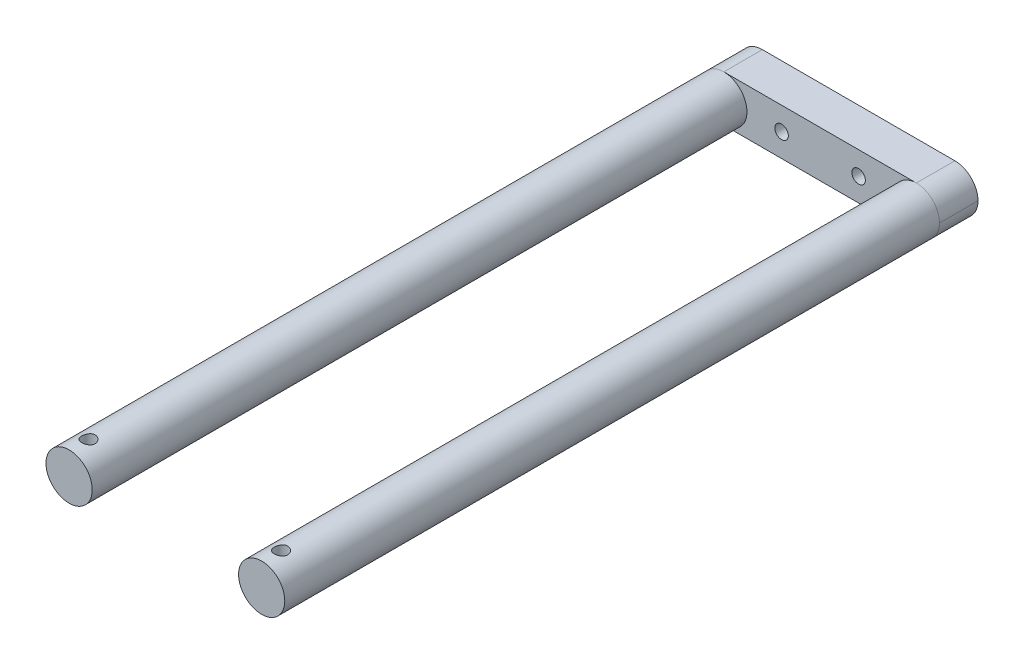
from build123d import *

# Parameters (mm, degrees)
SKETCH1_W               = 62
SKETCH1_H               = 12
BOSS_EXTRUDE1_DEPTH     = 10
SKETCH2_R               = 6
BOSS_EXTRUDE2_DEPTH     = 170
FILLET1_R               = 6
CUT_EXTRUDE3_DEPTH      = 183.748461006
CUT_EXTRUDE3_DEPTH_BACK = 183.748461006
SKETCH6_R               = 1.75
CUT_EXTRUDE4_REACH      = 184.748
SKETCH7_R               = 1.75


with BuildPart() as part:
    # Sketch1 → Boss-Extrude1 (new body)
    with BuildSketch(Plane.XY):
        Rectangle(SKETCH1_W, SKETCH1_H)
    extrude(amount=BOSS_EXTRUDE1_DEPTH)

    # Sketch2 → Boss-Extrude2 (add)
    with BuildSketch(Plane.XY.offset(10)):
        with Locations(Location((-25, 0, 0), (0, 0, 180))):
            Circle(SKETCH2_R)
        with Locations((25, 0)):
            Circle(SKETCH2_R)
    extrude(amount=BOSS_EXTRUDE2_DEPTH)

    # Fillet1
    fillet1_edges = [part.edges().sort_by_distance(p)[0] for p in [
        (-31, -6, 5),
        (-31, 6, 5),
        (31, 6, 5),
        (31, -6, 5),
    ]]
    fillet(fillet1_edges, radius=FILLET1_R - 0.0001)  # a hair under: the kernel refuses the full size

    # Sketch6 → Cut-Extrude3 (cut, two sides: drawn at the far end of the back side and taken through both)
    with BuildSketch(Plane(origin=(0, 0, 0), x_dir=(1, 0, 0), z_dir=(0, 1, 0)).offset(-CUT_EXTRUDE3_DEPTH_BACK)):
        with Locations(Location((-25, -175, 0), (0, 0, 270))):
            Circle(SKETCH6_R)
        with Locations(Location((25, -175, 0), (0, 0, 270))):
            Circle(SKETCH6_R)
    extrude(amount=CUT_EXTRUDE3_DEPTH + CUT_EXTRUDE3_DEPTH_BACK, mode=Mode.SUBTRACT)

    # Sketch7 → Cut-Extrude4 (cut, up to next)
    with BuildSketch(Plane(origin=(0, 0, 0), x_dir=(-1, 0, 0), z_dir=(0, 0, -1)), mode=Mode.PRIVATE) as cut_extrude4_sk1:
        with Locations((-10, 0)):
            Circle(SKETCH7_R)
    cut_extrude4_tool1 = extrude(cut_extrude4_sk1.sketch, amount=-CUT_EXTRUDE4_REACH, mode=Mode.PRIVATE) & part.part
    # Sketch7 → Cut-Extrude4 (cut, up to next)
    with BuildSketch(Plane(origin=(0, 0, 0), x_dir=(-1, 0, 0), z_dir=(0, 0, -1)), mode=Mode.PRIVATE) as cut_extrude4_sk2:
        with Locations((10, 0)):
            Circle(SKETCH7_R)
    cut_extrude4_tool2 = extrude(cut_extrude4_sk2.sketch, amount=-CUT_EXTRUDE4_REACH, mode=Mode.PRIVATE) & part.part
    add(cut_extrude4_tool1.solids().sort_by_distance((10, 0, 0))[0], mode=Mode.SUBTRACT)
    add(cut_extrude4_tool2.solids().sort_by_distance((-10, 0, 0))[0], mode=Mode.SUBTRACT)


solid = part.part
